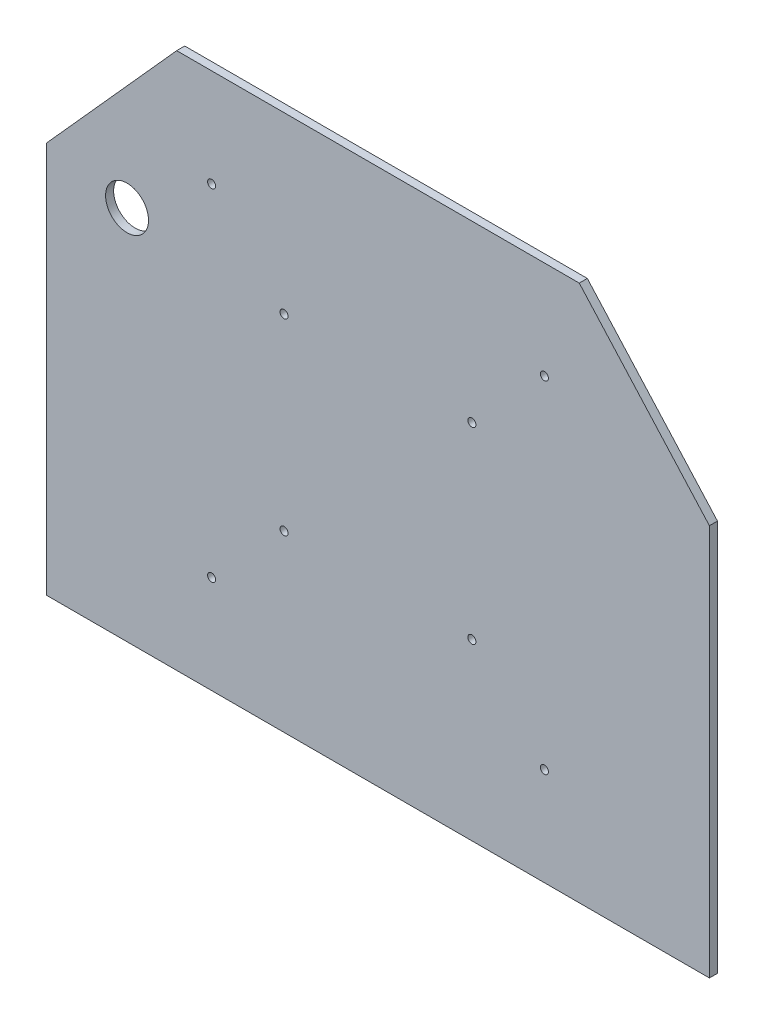
from build123d import *

# Parameters (mm, degrees)
BOSS_EXTRU_1_DEPTH      = 3
ENL_V_MAT_EXTRU_1_DEPTH = 345.268848431
ESQUISSE3_R             = 1.5
ENL_V_MAT_EXTRU_2_DEPTH = 331.898715622
ESQUISSE4_R             = 8
ENL_V_MAT_EXTRU_3_DEPTH = 331.898715622
ESQUISSE5_R             = 1.5
ENL_V_MAT_EXTRU_4_DEPTH = 331.898715622


with BuildPart() as part:
    # Esquisse1 → Boss.-Extru.1 (new body)
    with BuildSketch(Plane.XY):
        Polygon((0, 0), (0, 127.45), (65.1, 200), (215.1, 200), (280.2, 127.45), (280.2, 0), align=None)
    extrude(amount=BOSS_EXTRU_1_DEPTH)

    # Esquisse2 → Enlèv. mat.-Extru.1 (cut, through all)
    with BuildSketch(Plane(origin=(0, 0, 0), x_dir=(-1, 0, 0), z_dir=(0, 0, -1))):
        Polygon((-16.6, 0), (-16.6, 145.969439351), (0, 127.45), (0, 0), align=None)
        Polygon((-280.2, 127.45), (-263.6, 145.969439351), (-263.6, 0), (-280.2, 0), align=None)
    extrude(amount=-ENL_V_MAT_EXTRU_1_DEPTH, mode=Mode.SUBTRACT)

    # Esquisse3 → Enlèv. mat.-Extru.2 (cut, through all)
    with BuildSketch(Plane.XY.offset(3)):
        with Locations((78.1, 163.5)):
            Circle(ESQUISSE3_R)
        with Locations((78.1, 36.5)):
            Circle(ESQUISSE3_R)
        with Locations((202.1, 36.5)):
            Circle(ESQUISSE3_R)
        with Locations((202.1, 163.5)):
            Circle(ESQUISSE3_R)
    extrude(amount=-ENL_V_MAT_EXTRU_2_DEPTH, mode=Mode.SUBTRACT)

    # Esquisse4 → Enlèv. mat.-Extru.3 (cut, through all)
    with BuildSketch(Plane.XY.offset(3)):
        with Locations((46.6, 140)):
            Circle(ESQUISSE4_R)
    extrude(amount=-ENL_V_MAT_EXTRU_3_DEPTH, mode=Mode.SUBTRACT)

    # Esquisse5 → Enlèv. mat.-Extru.4 (cut, through all)
    with BuildSketch(Plane.XY.offset(3)):
        with Locations((105.1, 65)):
            Circle(ESQUISSE5_R)
        with Locations((105.1, 135)):
            Circle(ESQUISSE5_R)
        with Locations((175.1, 135)):
            Circle(ESQUISSE5_R)
        with Locations((175.1, 65)):
            Circle(ESQUISSE5_R)
    extrude(amount=-ENL_V_MAT_EXTRU_4_DEPTH, mode=Mode.SUBTRACT)


solid = part.part
